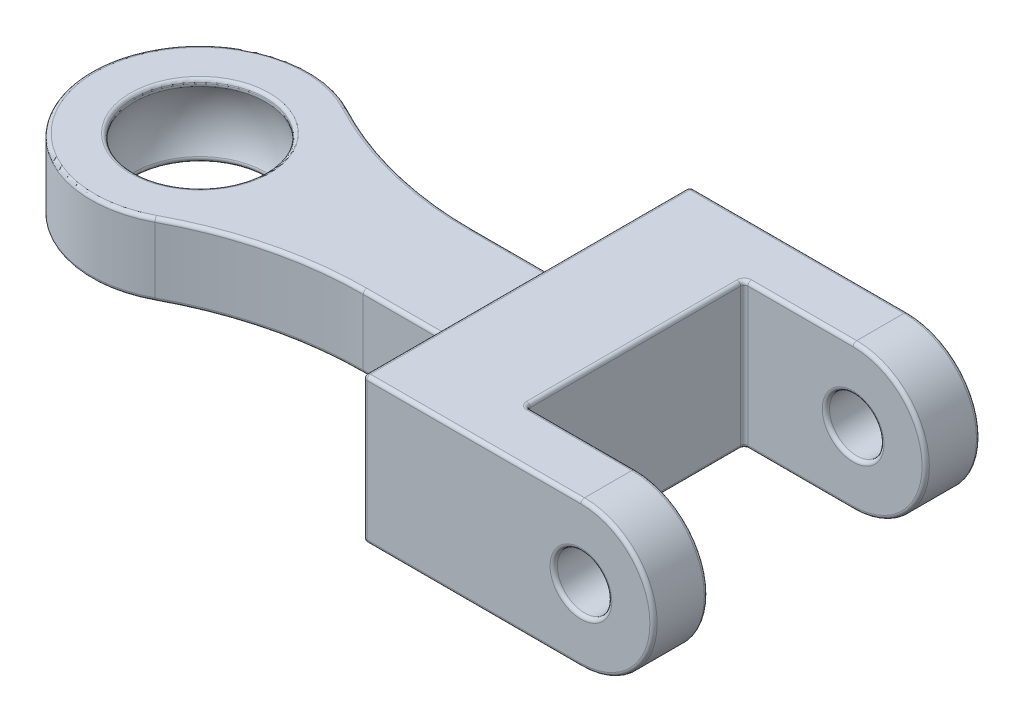
from build123d import *

# Parameters (mm, degrees)
SKETCH1_R               = 0.75
BOSS_EXTRUDE1_DEPTH     = 4.5
CUT_EXTRUDE1_DEPTH      = 8.762087348
CUT_EXTRUDE1_DEPTH_BACK = 8.762087348
SKETCH2_W               = 6
SKETCH2_H               = 6
SKETCH4_R               = 1.375
BOSS_EXTRUDE2_DEPTH     = 1
FILLET1_R               = 0.25
CHAMFER1_SIZE           = 0.109807621
CHAMFER1_SIZE_2         = 0.15
FILLET2_R               = 0.1


with BuildPart() as part:
    # Sketch1 → Boss-Extrude1 (new, symmetric)
    with BuildSketch(Plane.XY):
        with BuildLine():
            Line((0, 2), (-6, 2))
            Line((-6, 2), (-6, -2))
            Line((-6, -2), (0, -2))
            ThreePointArc((0, -2), (2, 0), (0, 2))
        make_face()
        Circle(SKETCH1_R, mode=Mode.SUBTRACT)
    extrude(amount=BOSS_EXTRUDE1_DEPTH, both=True)

    # Sketch2 → Cut-Extrude1 (cut, two sides: drawn at the far end of the back side and taken through both)
    with BuildSketch(Plane(origin=(0, 0, 0), x_dir=(1, 0, 0), z_dir=(0, 1, 0)).offset(-CUT_EXTRUDE1_DEPTH_BACK)):
        Rectangle(SKETCH2_W, SKETCH2_H)
    extrude(amount=CUT_EXTRUDE1_DEPTH + CUT_EXTRUDE1_DEPTH_BACK, mode=Mode.SUBTRACT)

    # Sketch4 → Boss-Extrude2 (add, symmetric)
    with BuildSketch(Plane(origin=(0, 0, 0), x_dir=(1, 0, 0), z_dir=(0, 1, 0))):
        with BuildLine():
            Line((-6, 1.5), (-6, -1.5))
            Line((-6, -1.5), (-9, -1.5))
            ThreePointArc((-9, -1.5), (-11.364722344, -1.791110624), (-13.588235294, -2.647058824))
            ThreePointArc((-13.588235294, -2.647058824), (-18, 0), (-13.588235294, 2.647058824))
            ThreePointArc((-13.588235294, 2.647058824), (-11.364722344, 1.791110624), (-9, 1.5))
            Line((-9, 1.5), (-6, 1.5))
        make_face()
        with Locations(Location((-15, 0, 0), (0, 0, 270))):
            Circle(SKETCH4_R, mode=Mode.SUBTRACT)
    extrude(amount=BOSS_EXTRUDE2_DEPTH, both=True)


with BuildPart() as body_2:
    # Sketch5 → Revolve1 (revolve)
    with BuildSketch(Plane(origin=(0, 0, 0), x_dir=(1, 0, 0), z_dir=(0, 1, 0))):
        with BuildLine():
            Line((-15, 2), (-15, -2))
            ThreePointArc((-15, -2), (-17, 0), (-15, 2))
        make_face()
    revolve(axis=Axis((-15, 0, -2), (0, 0, 1)))


with BuildPart() as part_1:
    add(part.part)

    # Combine1: cut body 2
    add(body_2.part, mode=Mode.SUBTRACT)

    # Fillet1
    fillet1_edges = [part_1.edges().sort_by_distance(p)[0] for p in [
        (-6, 1, 0),
        (-6, 0, -1.5),
        (-6, -1, 0),
        (-6, 0, 1.5),
    ]]
    fillet(fillet1_edges, radius=FILLET1_R)

    # Chamfer1
    # the kernel refuses this chamfer: 0.15, 0.109807621 mm, written as the material it takes off along each edge
    with BuildSketch(Plane(origin=(-15, 1, 0), x_dir=(0, 0, -1), z_dir=(-1, 0, 0))) as chamfer1_piece_1:
        with BuildLine():
            Line((1.732050808 + CHAMFER1_SIZE * 1.00000000123, 0), (1.804817612, 0.138238208))
            ThreePointArc((1.804817612, 0.138238208), (1.770811144, 0.070361418), (1.732050808, 0))
            Line((1.732050808, 0), (1.732050808 + CHAMFER1_SIZE * 1.00000000123, 0))
        make_face()
    revolve(axis=Axis((-15, 1, 0), (0, -1, 0)), mode=Mode.SUBTRACT)
    with BuildSketch(Plane(origin=(-15, -1, 0), x_dir=(0, 0, -1), z_dir=(-1, 0, 0))) as chamfer1_piece_2:
        with BuildLine():
            Line((1.732050808 + CHAMFER1_SIZE_2, 0), (1.784713088, -0.097337719))
            ThreePointArc((1.784713088, -0.097337719), (1.759463418, -0.049059161), (1.732050808, 0))
            Line((1.732050808, 0), (1.732050808 + CHAMFER1_SIZE_2, 0))
        make_face()
    revolve(axis=Axis((-15, -1, 0), (0, -1, 0)), mode=Mode.SUBTRACT)

    # Fillet2
    fillet2_edges = [part_1.edges().sort_by_distance(p)[0] for p in [
        (-0.75, 0, -4.5),
        (-0.75, 0, 4.5),
        (-6, 0, 4.5),
        (-3, -2, 4.5),
        (-1.5, -2, 3),
        (2, 0, 3),
        (-0.75, 0, 3),
        (2, 0, -3),
        (-1.5, -2, -3),
        (-3, 0, -3),
        (-0.75, 0, -3),
        (-3, 0, 3),
        (-3, -2, 0),
        (-1.5, 2, 3),
        (-1.5, 2, -3),
        (-3, 2, 0),
        (-11.364722344, 1, -1.791110624),
        (-18, 1, 0),
        (-11.364722344, 1, 1.791110624),
        (-7.625, 1, 1.5),
        (-11.364722344, -1, -1.791110624),
        (-18, -1, 0),
        (-11.364722344, -1, 1.791110624),
        (-7.625, -1, 1.5),
        (2, 0, 4.5),
        (-3, -2, -4.5),
        (-6, 0, -4.5),
        (-3, 2, -4.5),
        (2, 0, -4.5),
        (-7.625, -1, -1.5),
        (-7.625, 1, -1.5),
        (-6.059175996, 1.088487773, 1.588487773),
        (-6.059175996, -1.088487773, 1.588487773),
        (-6.059175996, 1.088487773, -1.588487773),
        (-6.059175996, -1.088487773, -1.588487773),
        (-6, -2, 0),
        (-6, 2, 0),
        (-15, 0.861761792, 1.804817612),
        (-15, -0.902662281, 1.784713088),
        (-15, -1, 1.882050808),
        (-15, 1, 1.841858429),
        (-3, 2, 4.5),
    ]]
    fillet(fillet2_edges, radius=FILLET2_R)


solid = part_1.part
